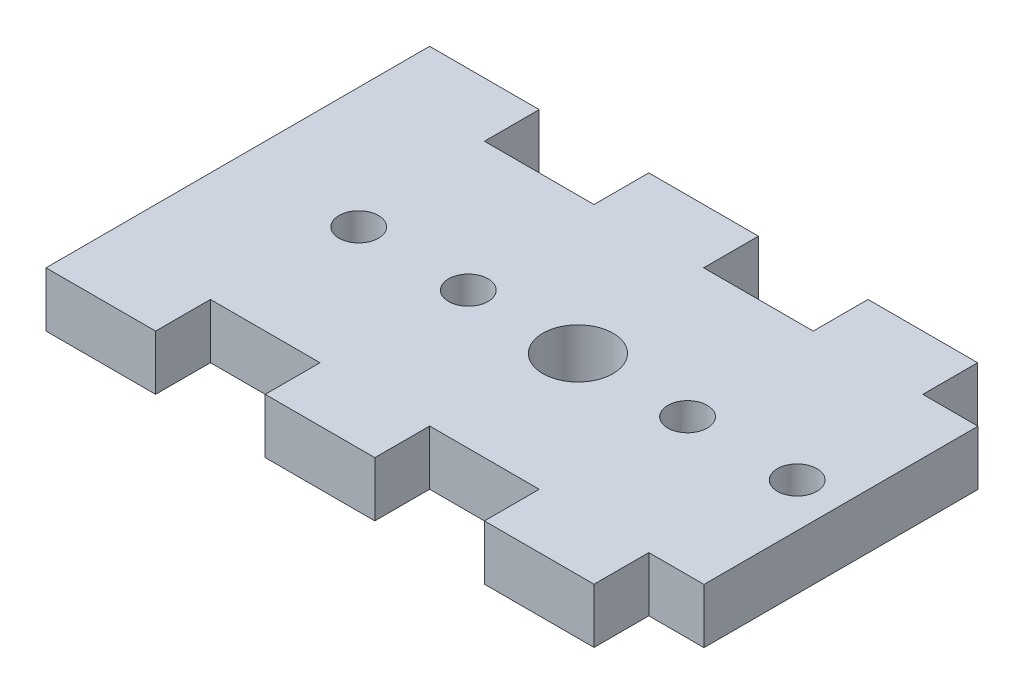
from build123d import *

# Parameters (mm, degrees)
MAIN_DEPTH             = 6.35
SKETCH3_R              = 4.064
SKETCH3_R_2            = 2.286
GEAR_MOUNT_HOLES_DEPTH = 49.977398104
SKETCH4_W              = 11.058415147
SKETCH4_H              = 31.75
SKETCH4_W_2            = 5.4102
CUT_EXTRUDE2_DEPTH     = 49.977398104


with BuildPart() as part:
    # Sketch1 → Main (new body)
    with BuildSketch(Plane(origin=(0, 0, 0), x_dir=(1, 0, 0), z_dir=(0, 1, 0))):
        Polygon((-43.18, 15.875), (-37.7698, 15.875), (-37.7698, 22.225), (-25.0698, 22.225), (-25.0698, 15.875), (-12.3698, 15.875), (-12.3698, 22.225), (0.3302, 22.225), (0.3302, 15.875), (13.0302, 15.875), (13.0302, 22.225), (25.7302, 22.225), (25.7302, 15.875), (43.18, 15.875), (43.18, -15.875), (25.7302, -15.875), (25.7302, -22.225), (13.0302, -22.225), (13.0302, -15.875), (0.3302, -15.875), (0.3302, -22.225), (-12.3698, -22.225), (-12.3698, -15.875), (-25.0698, -15.875), (-25.0698, -22.225), (-37.7698, -22.225), (-37.7698, -15.875), (-43.18, -15.875), align=None)
    extrude(amount=MAIN_DEPTH)

    # Sketch3 → Gear Mount Holes (cut, through all)
    with BuildSketch(Plane(origin=(0, 6.35, 0), x_dir=(1, 0, 0), z_dir=(0, 1, 0))):
        with Locations((1.641584853, 0)):
            Circle(SKETCH3_R)
        with Locations((14.341584853, 0)):
            Circle(SKETCH3_R_2)
        with Locations((27.041584853, 0)):
            Circle(SKETCH3_R_2)
        with Locations((-11.058415147, 0)):
            Circle(SKETCH3_R_2)
        with Locations((-23.758415147, 0)):
            Circle(SKETCH3_R_2)
    extrude(amount=-GEAR_MOUNT_HOLES_DEPTH, mode=Mode.SUBTRACT)

    # Sketch4 → Cut-Extrude2 (cut, through all)
    with BuildSketch(Plane(origin=(0, 6.35, 0), x_dir=(1, 0, 0), z_dir=(0, 1, 0))):
        with Locations((37.650792427, 0)):
            Rectangle(SKETCH4_W, SKETCH4_H)
        with Locations((-40.4749, 0)):
            Rectangle(SKETCH4_W_2, SKETCH4_H)
    extrude(amount=-CUT_EXTRUDE2_DEPTH, mode=Mode.SUBTRACT)


solid = part.part
